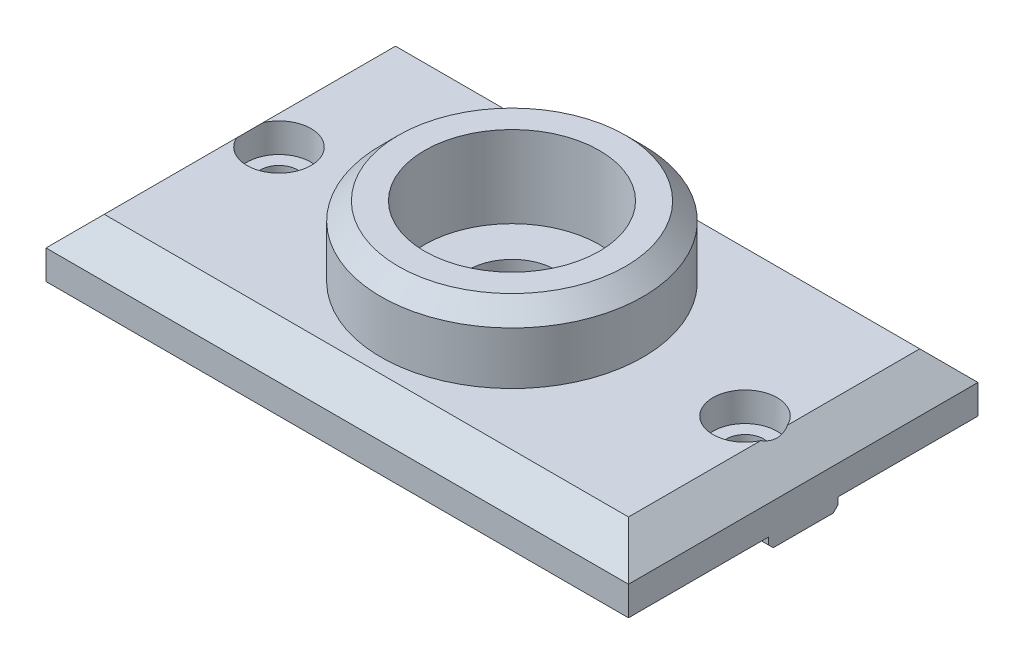
from build123d import *

# Parameters (mm, degrees)
SKETCH1_W               = 100
SKETCH1_H               = 60
BOSS_EXTRUDE1_DEPTH     = 10
BOSS_EXTRUDE2_START     = 10
SKETCH3_R               = 22.5
BOSS_EXTRUDE2_DEPTH     = 12
CUT_EXTRUDE2_START      = 22
SKETCH4_R               = 15
CUT_EXTRUDE2_DEPTH      = 14
SKETCH6_W               = 100
SKETCH6_H               = 11.9
BOSS_EXTRUDE3_DEPTH     = 2
CUT_EXTRUDE1_DEPTH      = 63.321745804
CUT_EXTRUDE1_DEPTH_BACK = 63.321745804
SKETCH2_R               = 3.2
CUT_EXTRUDE3_DEPTH      = 63.321745804
CUT_EXTRUDE3_DEPTH_BACK = 63.321745804
SKETCH5_R               = 7.5
CUT_EXTRUDE4_START      = 10
SKETCH8_R               = 5.5
CUT_EXTRUDE4_DEPTH      = 5
CHAMFER1_SIZE           = 5
CHAMFER2_SIZE           = 3
CHAMFER3_SIZE           = 0.8


with BuildPart() as part:
    # Sketch1 → Boss-Extrude1 (new body)
    with BuildSketch(Plane(origin=(0, 0, 0), x_dir=(1, 0, 0), z_dir=(0, 1, 0))):
        Rectangle(SKETCH1_W, SKETCH1_H)
    extrude(amount=BOSS_EXTRUDE1_DEPTH)

    # Sketch3 → Boss-Extrude2 (add)
    with BuildSketch(Plane(origin=(0, 0, 0), x_dir=(1, 0, 0), z_dir=(0, 1, 0)).offset(BOSS_EXTRUDE2_START)):
        with Locations(Location((0, 0, 0), (0, 0, 90))):
            Circle(SKETCH3_R)
    extrude(amount=BOSS_EXTRUDE2_DEPTH)

    # Sketch4 → Cut-Extrude2 (cut)
    with BuildSketch(Plane(origin=(0, 0, 0), x_dir=(1, 0, 0), z_dir=(0, 1, 0)).offset(CUT_EXTRUDE2_START)):
        with Locations(Location((0, 0, 0), (0, 0, 90))):
            Circle(SKETCH4_R)
    extrude(amount=-CUT_EXTRUDE2_DEPTH, mode=Mode.SUBTRACT)

    # Sketch6 → Boss-Extrude3 (add)
    with BuildSketch(Plane(origin=(0, 0, 0), x_dir=(1, 0, 0), z_dir=(0, 1, 0))):
        Rectangle(SKETCH6_W, SKETCH6_H)
    extrude(amount=-BOSS_EXTRUDE3_DEPTH)

    # Sketch2 → Cut-Extrude1 (cut, two sides: drawn at the far end of the back side and taken through both)
    with BuildSketch(Plane(origin=(0, 0, 0), x_dir=(1, 0, 0), z_dir=(0, 1, 0)).offset(-CUT_EXTRUDE1_DEPTH_BACK)):
        with Locations(Location((-40, 0, 0), (0, 0, 90))):
            Circle(SKETCH2_R)
        with Locations(Location((40, 0, 0), (0, 0, 90))):
            Circle(SKETCH2_R)
    extrude(amount=CUT_EXTRUDE1_DEPTH + CUT_EXTRUDE1_DEPTH_BACK, mode=Mode.SUBTRACT)

    # Sketch5 → Cut-Extrude3 (cut, two sides: drawn at the far end of the back side and taken through both)
    with BuildSketch(Plane(origin=(0, 0, 0), x_dir=(1, 0, 0), z_dir=(0, 1, 0)).offset(-CUT_EXTRUDE3_DEPTH_BACK)):
        with Locations(Location((0, 0, 0), (0, 0, 90))):
            Circle(SKETCH5_R)
    extrude(amount=CUT_EXTRUDE3_DEPTH + CUT_EXTRUDE3_DEPTH_BACK, mode=Mode.SUBTRACT)

    # Sketch8 → Cut-Extrude4 (cut)
    with BuildSketch(Plane(origin=(0, 0, 0), x_dir=(1, 0, 0), z_dir=(0, 1, 0)).offset(CUT_EXTRUDE4_START)):
        with Locations(Location((40, 0, 0), (0, 0, 90))):
            Circle(SKETCH8_R)
        with Locations(Location((-40, 0, 0), (0, 0, 90))):
            Circle(SKETCH8_R)
    extrude(amount=-CUT_EXTRUDE4_DEPTH, mode=Mode.SUBTRACT)

    # Chamfer1
    # the kernel refuses this chamfer: 5 mm, written as the material it takes off along each edge
    with BuildSketch(Plane(origin=(-50, 10, -42.85841494), x_dir=(0.9996219169112968, 0.027495876610586317, 0), z_dir=(0, 0, 1)), Plane(origin=(50, 10, 42.85841494), x_dir=(-0.9996219169112968, 0.027495876610586317, 0), z_dir=(0, 0, -1))) as chamfer1_piece_1:
        Polygon((CHAMFER1_SIZE * 0.999621916911, -CHAMFER1_SIZE * 0.0274958766106), (-CHAMFER1_SIZE * 0.0274958766106, -CHAMFER1_SIZE * 0.999621916911), (0, 0), align=None)
    extrude(amount=85.71682988, mode=Mode.SUBTRACT)
    with BuildSketch(Plane(origin=(-62.85841494, 10, 30), x_dir=(0, -0.9996219169112968, 0.027495876610586317), z_dir=(1, 0, 0))) as chamfer1_piece_2:
        Polygon((CHAMFER1_SIZE * 0.999621916911, CHAMFER1_SIZE * 0.0274958766106), (-CHAMFER1_SIZE * 0.0274958766106, CHAMFER1_SIZE * 0.999621916911), (0, 0), align=None)
    extrude(amount=125.71682988, mode=Mode.SUBTRACT)
    with BuildSketch(Plane(origin=(62.85841494, 10, -30), x_dir=(0, 0.027495876610586317, 0.9996219169112968), z_dir=(-1, 0, 0))) as chamfer1_piece_3:
        Polygon((CHAMFER1_SIZE * 0.999621916911, -CHAMFER1_SIZE * 0.0274958766106), (-CHAMFER1_SIZE * 0.0274958766106, -CHAMFER1_SIZE * 0.999621916911), (0, 0), align=None)
    extrude(amount=125.71682988, mode=Mode.SUBTRACT)

    # Chamfer2
    chamfer2_edges = [part.edges().sort_by_distance(p)[0] for p in [
        (0, 22, 22.5),
    ]]
    chamfer(chamfer2_edges, length=CHAMFER2_SIZE)

    # Chamfer3
    chamfer3_edges = [part.edges().sort_by_distance(p)[0] for p in [
        (27.282953131, -2, -5.95),
        (-27.282953131, -2, 5.95),
        (-27.282953131, -2, -5.95),
        (27.282953131, -2, 5.95),
    ]]
    chamfer(chamfer3_edges, length=CHAMFER3_SIZE)


solid = part.part
